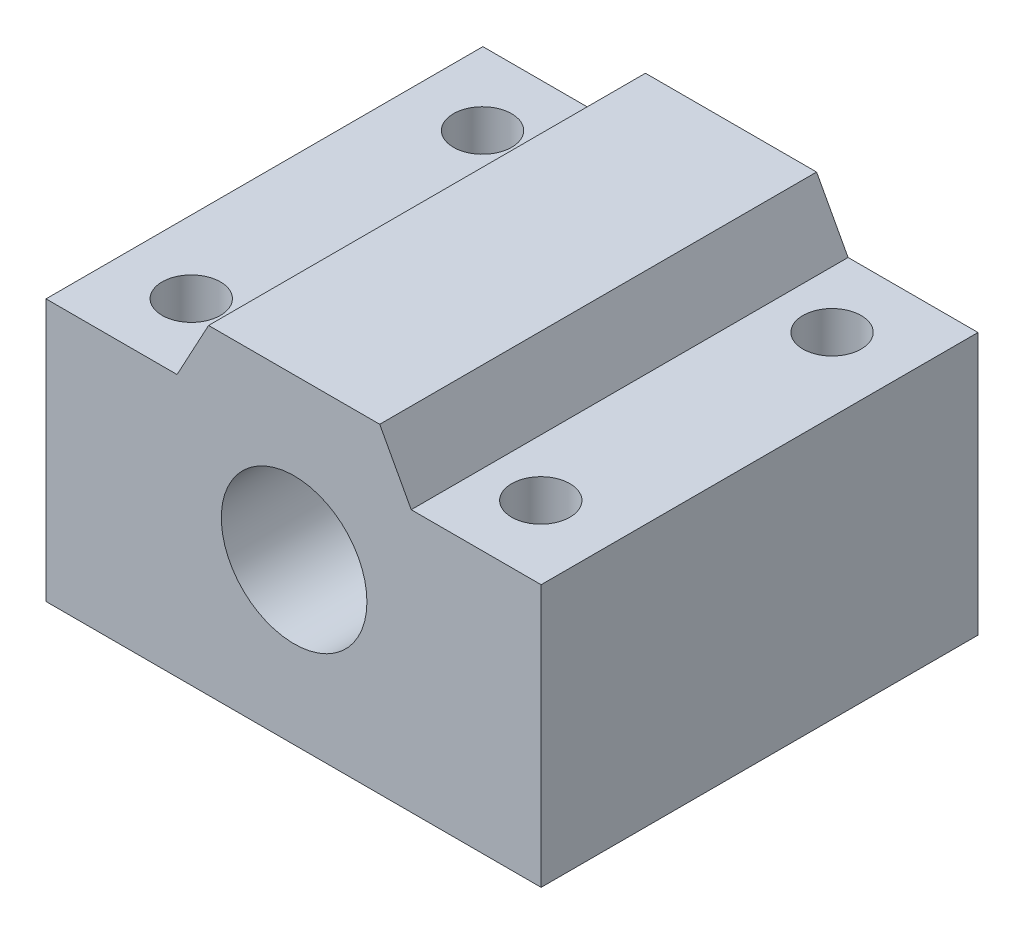
from build123d import *

# Parameters (mm, degrees)
BOSS_EXTRUDE2_DEPTH    = 30
HOLE_R                 = 5
CUT_EXTRUDE1_DEPTH     = 30
CUT_EXTRUDE2_START     = -10.999447078
CUT_EXTRUDE2_OUTLINE_R = 2
CUT_EXTRUDE2_DEPTH     = 17.999956595


# Read off the part's stored shape, not the designer's step: Cut-Extrude2
with BuildPart() as part:
    # body → Boss-Extrude2 (new body)
    with BuildSketch(Plane.XY):
        Polygon((-8.038514806, 7.000509517), (-5.875565247, 11.000552922), (5.877594601, 11.000552922), (8.04054416, 7.000509517), (16.961485195, 7.000509517), (16.961485195, -10.999447078), (-17.038514805, -10.999447078), (-17.038514805, 7.000509517), align=None)
    extrude(amount=-BOSS_EXTRUDE2_DEPTH)

    # hole → Cut-Extrude1 (cut)
    with BuildSketch(Plane.XY):
        Circle(HOLE_R)
    extrude(amount=-CUT_EXTRUDE1_DEPTH, mode=Mode.SUBTRACT)

    # Cut-Extrude2 outline → Cut-Extrude2 (cut)
    with BuildSketch(Plane(origin=(0, 0, 0), x_dir=(1, 0, 0), z_dir=(0, 1, 0)).offset(CUT_EXTRUDE2_START)):
        with Locations((-12.061902792, 5)):
            Circle(CUT_EXTRUDE2_OUTLINE_R)
        with Locations((-12.061902792, 24.999986325)):
            Circle(CUT_EXTRUDE2_OUTLINE_R)
        with Locations((11.938097208, 24.999986325)):
            Circle(CUT_EXTRUDE2_OUTLINE_R)
        with Locations((11.938097208, 5)):
            Circle(CUT_EXTRUDE2_OUTLINE_R)
    extrude(amount=CUT_EXTRUDE2_DEPTH, mode=Mode.SUBTRACT)


solid = part.part
